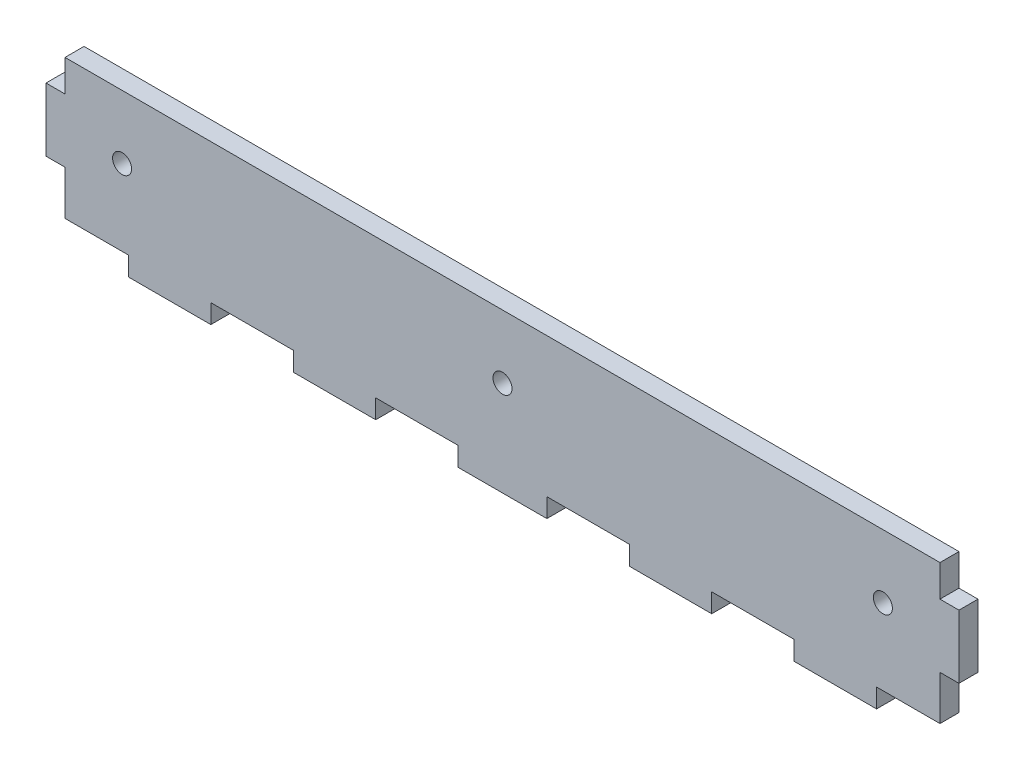
from build123d import *

# Parameters (mm, degrees)
SKETCH1_R           = 1.5
BOSS_EXTRUDE1_DEPTH = 3


with BuildPart() as part:
    # Sketch1 → Boss-Extrude1 (new body)
    with BuildSketch(Plane.XY):
        Polygon((0, 17), (0, 22), (138, 22), (138, 17), (141, 17), (141, 7), (138, 7), (138, 0), (128, 0), (128, -3), (115, -3), (115, 0), (102, 0), (102, -3), (89, -3), (89, 0), (76, 0), (76, -3), (62, -3), (62, 0), (49, 0), (49, -3), (36, -3), (36, 0), (23, 0), (23, -3), (10, -3), (10, 0), (0, 0), (0, 7), (-3, 7), (-3, 17), align=None)
        with Locations((9, 12)):
            Circle(SKETCH1_R, mode=Mode.SUBTRACT)
        with Locations((69, 12)):
            Circle(SKETCH1_R, mode=Mode.SUBTRACT)
        with Locations((129, 12)):
            Circle(SKETCH1_R, mode=Mode.SUBTRACT)
    extrude(amount=BOSS_EXTRUDE1_DEPTH)


solid = part.part
